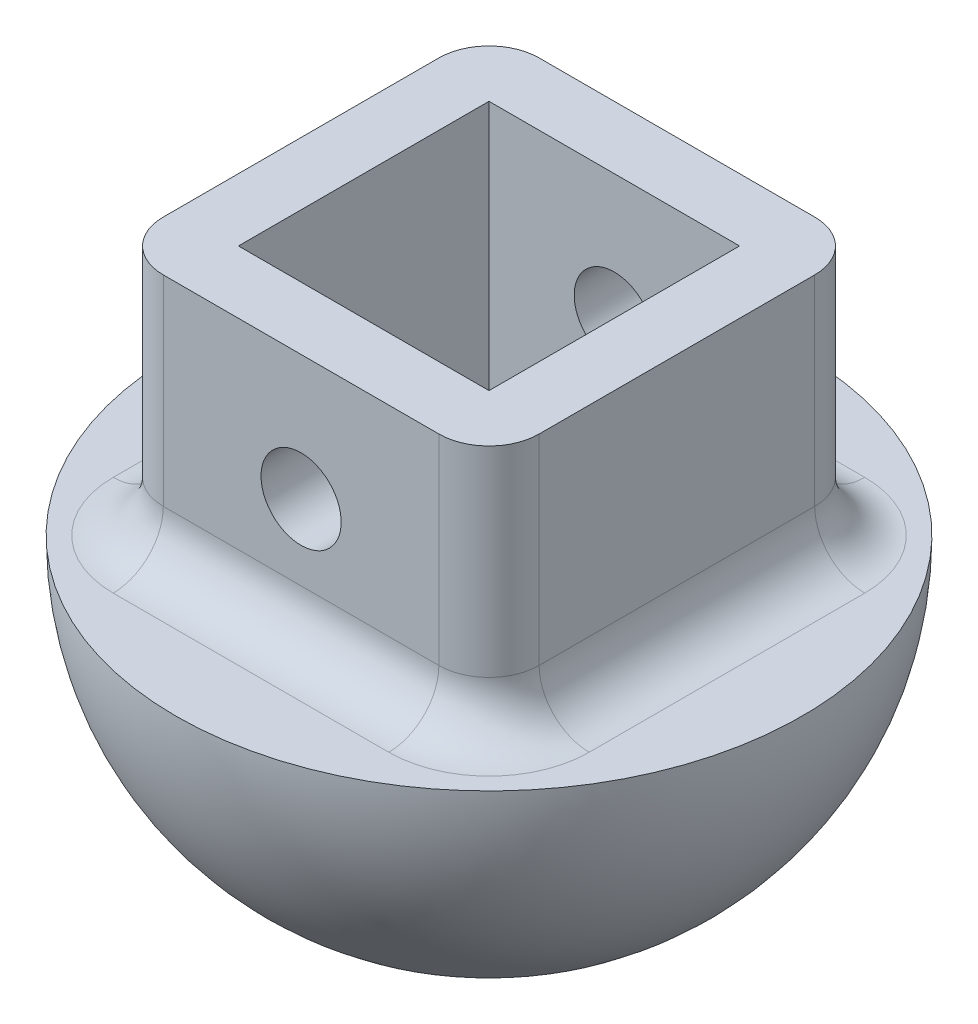
from build123d import *

# Parameters (mm, degrees)
REVOLVE2_ANGLE          = 180
SKETCH1_W               = 15
SKETCH1_H               = 15
SKETCH1_W_2             = 10
SKETCH1_H_2             = 10
BOSS_EXTRUDE1_DEPTH     = 10
CUT_EXTRUDE1_DEPTH      = 20
CUT_EXTRUDE1_DEPTH_BACK = 10
SKETCH2_R               = 1.6
FILLET1_R               = 2


with BuildPart() as part:
    # Sketch4 → Revolve2 (revolve)
    with BuildSketch(Plane(origin=(0, 0, 0), x_dir=(1, 0, 0), z_dir=(0, 1, 0))):
        with BuildLine():
            Line((12.5, 0), (-12.5, 0))
            ThreePointArc((-12.5, 0), (0, -12.5), (12.5, 0))
        make_face()
    revolve(axis=Axis((-12.5, 0, 0), (1, 0, 0)), revolution_arc=REVOLVE2_ANGLE)

    # Sketch1 → Boss-Extrude1 (add)
    with BuildSketch(Plane(origin=(0, 0, 0), x_dir=(1, 0, 0), z_dir=(0, 1, 0))):
        Rectangle(SKETCH1_W, SKETCH1_H)
        Rectangle(SKETCH1_W_2, SKETCH1_H_2, mode=Mode.SUBTRACT)
    extrude(amount=BOSS_EXTRUDE1_DEPTH)

    # Sketch2 → Cut-Extrude1 (cut, two sides: drawn at the far end of the back side and taken through both)
    with BuildSketch(Plane(origin=(0, 0, 5), x_dir=(-1, 0, 0), z_dir=(0, 0, -1)).offset(-CUT_EXTRUDE1_DEPTH_BACK)):
        with Locations((0, 5)):
            Circle(SKETCH2_R)
    extrude(amount=CUT_EXTRUDE1_DEPTH + CUT_EXTRUDE1_DEPTH_BACK, mode=Mode.SUBTRACT)

    # Fillet1
    fillet1_edges = [part.edges().sort_by_distance(p)[0] for p in [
        (-7.5, 5, 7.5),
        (-7.5, 5, -7.5),
        (7.5, 5, -7.5),
        (7.5, 5, 7.5),
        (0, 0, -7.5),
        (7.5, 0, 0),
        (-7.5, 0, 0),
        (0, 0, 7.5),
    ]]
    fillet(fillet1_edges, radius=FILLET1_R)


solid = part.part
